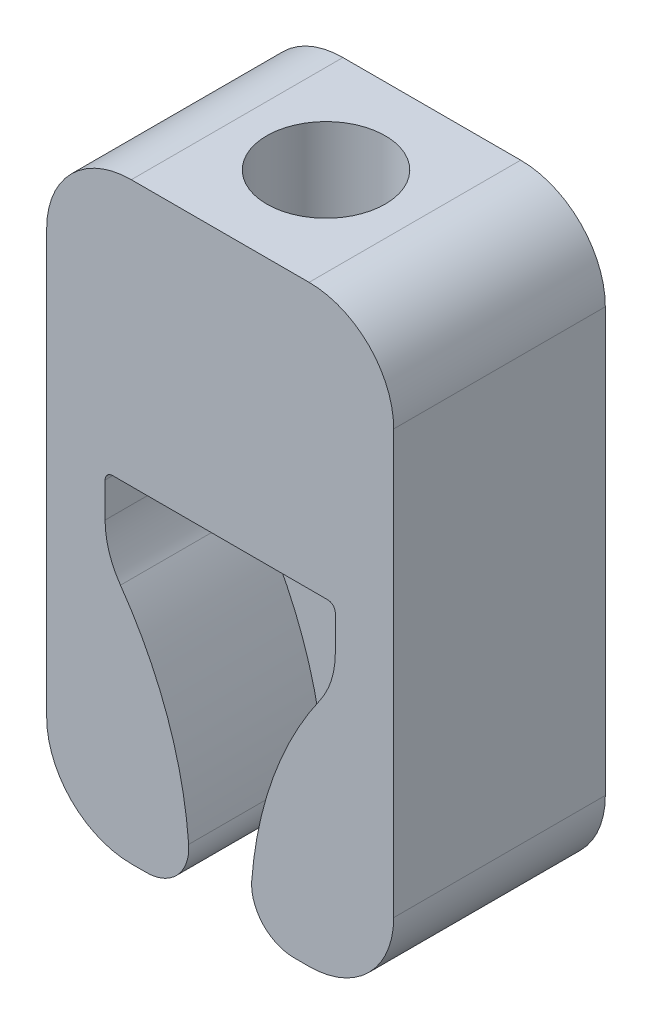
from build123d import *

# Parameters (mm, degrees)
SKETCH1_W                        = 41
SKETCH1_H                        = 70
BOSS_EXTRUDE1_DEPTH              = 25
CUT_EXTRUDE1_DEPTH               = 16
TAP_DRILL_FOR_M16X2_0_TAP1_D     = 14
TAP_DRILL_FOR_M16X2_0_TAP1_DEPTH = 24.377223398
TAP_DRILL_FOR_M16X2_0_TAP1_TIP   = 4.206024333
FILLET1_R                        = 10
FILLET2_R                        = 0.9
FILLET4_R                        = 5


with BuildPart() as part:
    # Sketch1 → Boss-Extrude1 (new body)
    with BuildSketch(Plane.XY):
        Rectangle(SKETCH1_W, SKETCH1_H)
    extrude(amount=BOSS_EXTRUDE1_DEPTH)

    # Sketch6 → Cut-Extrude1 (cut)
    with BuildSketch(Plane.XY.offset(25)):
        with BuildLine():
            Line((-3.6, -35), (-3.6, -33))
            ThreePointArc((-3.6, -33), (-5.694183484, -19.431989494), (-11.781818182, -7.126819144))
            ThreePointArc((-11.781818182, -7.126819144), (-13.134625892, -4.392336844), (-13.6, -1.377223398))
            Line((-13.6, -1.377223398), (-13.6, 3.622776602))
            Line((-13.6, 3.622776602), (13.6, 3.622776602))
            Line((13.6, 3.622776602), (13.6, -1.377223398))
            ThreePointArc((13.6, -1.377223398), (13.134625892, -4.392336844), (11.781818182, -7.126819144))
            ThreePointArc((11.781818182, -7.126819144), (5.694183484, -19.431989494), (3.6, -33))
            Line((3.6, -33), (3.6, -35))
            Line((3.6, -35), (-3.6, -35))
        make_face()
    extrude(amount=-CUT_EXTRUDE1_DEPTH, mode=Mode.SUBTRACT)

    # Tap Drill for M16x2.0 Tap1
    with Locations(Plane(origin=(0, 35, 0), x_dir=(1, 0, 0), z_dir=(0, 1, 0))):
        with Locations((0, -12.5)):
            Hole(TAP_DRILL_FOR_M16X2_0_TAP1_D / 2, depth=TAP_DRILL_FOR_M16X2_0_TAP1_DEPTH)
            with Locations((0, 0, -(TAP_DRILL_FOR_M16X2_0_TAP1_DEPTH + TAP_DRILL_FOR_M16X2_0_TAP1_TIP / 2))):  # 118° drill point
                Cone(0, TAP_DRILL_FOR_M16X2_0_TAP1_D / 2, TAP_DRILL_FOR_M16X2_0_TAP1_TIP, mode=Mode.SUBTRACT)

    # Fillet1
    fillet1_edges = [part.edges().sort_by_distance(p)[0] for p in [
        (20.5, -35, 12.5),
        (-20.5, -35, 12.5),
        (-20.5, 35, 12.5),
        (20.5, 35, 12.5),
    ]]
    fillet(fillet1_edges, radius=FILLET1_R)

    # Fillet2
    fillet2_edges = [part.edges().sort_by_distance(p)[0] for p in [
        (-13.6, 3.622776602, 17),
        (13.6, 3.622776602, 17),
    ]]
    fillet(fillet2_edges, radius=FILLET2_R)

    # Fillet4
    # the kernel refuses this fillet: 5 mm, written as the material it takes off along each edge
    with BuildSketch(Plane(origin=(3.6, -35, 38.441235127), x_dir=(1, 0, 0), z_dir=(0, 0, -1))) as fillet4_piece_1:
        with BuildLine():
            CenterArc((5.11265865, -5), FILLET4_R, 90, 94.301222305)
            Line((0.126740981, -5.375), (-0.371850786, -5.4125))
            ThreePointArc((-0.371850786, -5.4125), (-0.5, -2), (-0.5, 0))
            Line((-0.5, 0), (0, 0.5))
            Line((0, 0.5), (5.11265865, 0.5))
            Line((5.11265865, 0.5), (5.11265865, 0))
        make_face()
    extrude(amount=29.441235127, mode=Mode.SUBTRACT)
    with BuildSketch(Plane(origin=(-3.6, -35, 38.441235127), x_dir=(-0.0235731649015064, 0.9997221143380427, 0), z_dir=(0, 0, -1))) as fillet4_piece_2:
        with BuildLine():
            CenterArc((5.119132117, -4.993372091), FILLET4_R, 87.049545676, 94.301222305)
            Line((0.120521545, -5.111237915), (-0.379339512, -5.123024498))
            Line((-0.379339512, -5.123024498), (-0.499861057, -0.011786582))
            Line((-0.499861057, -0.011786582), (-0.011786582, 0.499861057))
            ThreePointArc((-0.011786582, 0.499861057), (1.987657646, 0.547007387), (5.402230244, 0.499337209))
            Line((5.402230244, 0.499337209), (5.376494051, 0))
        make_face()
    extrude(amount=29.441235127, mode=Mode.SUBTRACT)


solid = part.part
